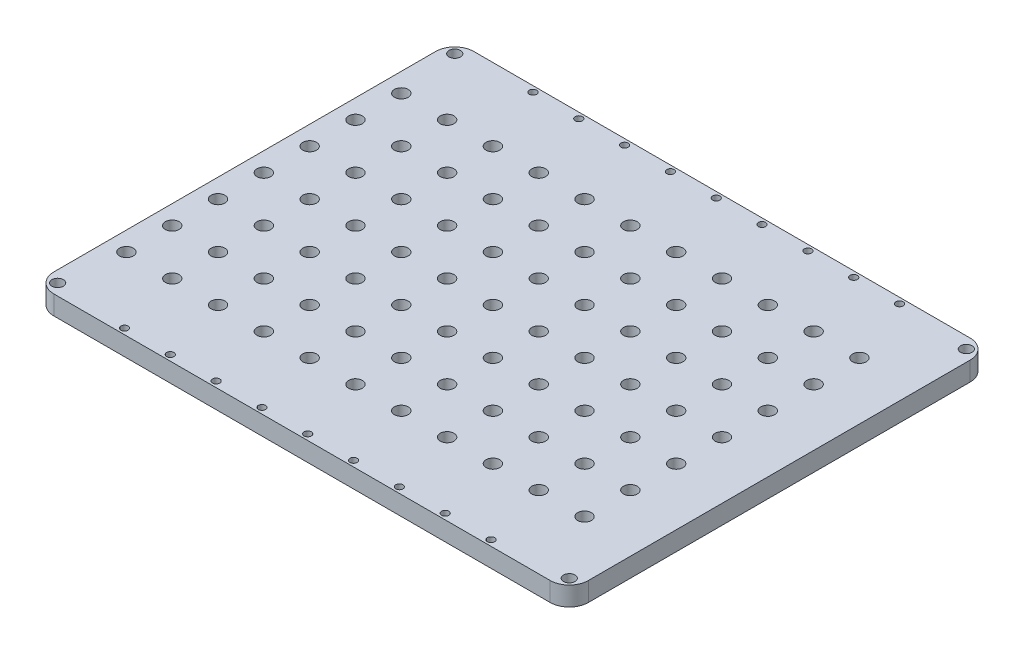
from build123d import *

# Parameters (mm, degrees)
SKETCH1_W           = 140
SKETCH1_H           = 110
BOSS_EXTRUDE1_DEPTH = 5
FILLET1_R           = 5
SKETCH2_R           = 1.5
CUT_EXTRUDE1_DEPTH  = 5
SKETCH3_R           = 0.95
CUT_EXTRUDE2_DEPTH  = 5
SKETCH4_R           = 1.8
CUT_EXTRUDE5_DEPTH  = 5
LPATTERN2_COUNT     = 11
LPATTERN2_PITCH     = 12


with BuildPart() as part:
    # Sketch1 → Boss-Extrude1 (new body)
    with BuildSketch(Plane(origin=(0, 0, 0), x_dir=(1, 0, 0), z_dir=(0, 1, 0))):
        Rectangle(SKETCH1_W, SKETCH1_H)
    extrude(amount=BOSS_EXTRUDE1_DEPTH)

    # Fillet1
    fillet1_edges = [part.edges().sort_by_distance(p)[0] for p in [
        (70, 2.5, -55),
        (70, 2.5, 55),
        (-70, 2.5, 55),
        (-70, 2.5, -55),
    ]]
    fillet(fillet1_edges, radius=FILLET1_R)

    # Sketch2 → Cut-Extrude1 (cut)
    with BuildSketch(Plane(origin=(0, 5, 0), x_dir=(1, 0, 0), z_dir=(0, 1, 0))):
        with Locations((66.998887809, -51.998887809)):
            Circle(SKETCH2_R)
        with Locations((66.998887809, 52.001112191)):
            Circle(SKETCH2_R)
        with Locations((-67.001112191, -51.998887809)):
            Circle(SKETCH2_R)
        with Locations((-67.001112191, 52.001112191)):
            Circle(SKETCH2_R)
    extrude(amount=-CUT_EXTRUDE1_DEPTH, mode=Mode.SUBTRACT)

    # Sketch3 → Cut-Extrude2 (cut)
    with BuildSketch(Plane(origin=(0, 5, 0), x_dir=(1, 0, 0), z_dir=(0, 1, 0))):
        with Locations((0, -53.5)):
            Circle(SKETCH3_R)
        with Locations((12, -53.5)):
            Circle(SKETCH3_R)
        with Locations((24, -53.5)):
            Circle(SKETCH3_R)
        with Locations((36, -53.5)):
            Circle(SKETCH3_R)
        with Locations((48, -53.5)):
            Circle(SKETCH3_R)
        with Locations((-12, -53.5)):
            Circle(SKETCH3_R)
        with Locations((-24, -53.5)):
            Circle(SKETCH3_R)
        with Locations((-36, -53.5)):
            Circle(SKETCH3_R)
        with Locations((-48, -53.5)):
            Circle(SKETCH3_R)
    cut_extrude2 = extrude(amount=-CUT_EXTRUDE2_DEPTH, mode=Mode.SUBTRACT)

    # Mirror1: Cut-Extrude2 across plane
    add(cut_extrude2.mirror(Plane.XY), mode=Mode.SUBTRACT)

    # Sketch4 → Cut-Extrude5 (cut)
    with BuildSketch(Plane(origin=(0, 5, 0), x_dir=(1, 0, 0), z_dir=(0, 1, 0))):
        with Locations((-65, 0)):
            Circle(SKETCH4_R)
        with Locations((-65, 12)):
            Circle(SKETCH4_R)
        with Locations((-65, 24)):
            Circle(SKETCH4_R)
        with Locations((-65, 36)):
            Circle(SKETCH4_R)
        with Locations((-65, -12)):
            Circle(SKETCH4_R)
        with Locations((-65, -24)):
            Circle(SKETCH4_R)
        with Locations((-65, -36)):
            Circle(SKETCH4_R)
    cut_extrude5 = extrude(amount=-CUT_EXTRUDE5_DEPTH, mode=Mode.SUBTRACT)

    # LPattern2: Cut-Extrude5 ×11
    with Locations(*[(i * LPATTERN2_PITCH, 0, 0) for i in range(1, LPATTERN2_COUNT)]):
        add(cut_extrude5, mode=Mode.SUBTRACT)


solid = part.part
